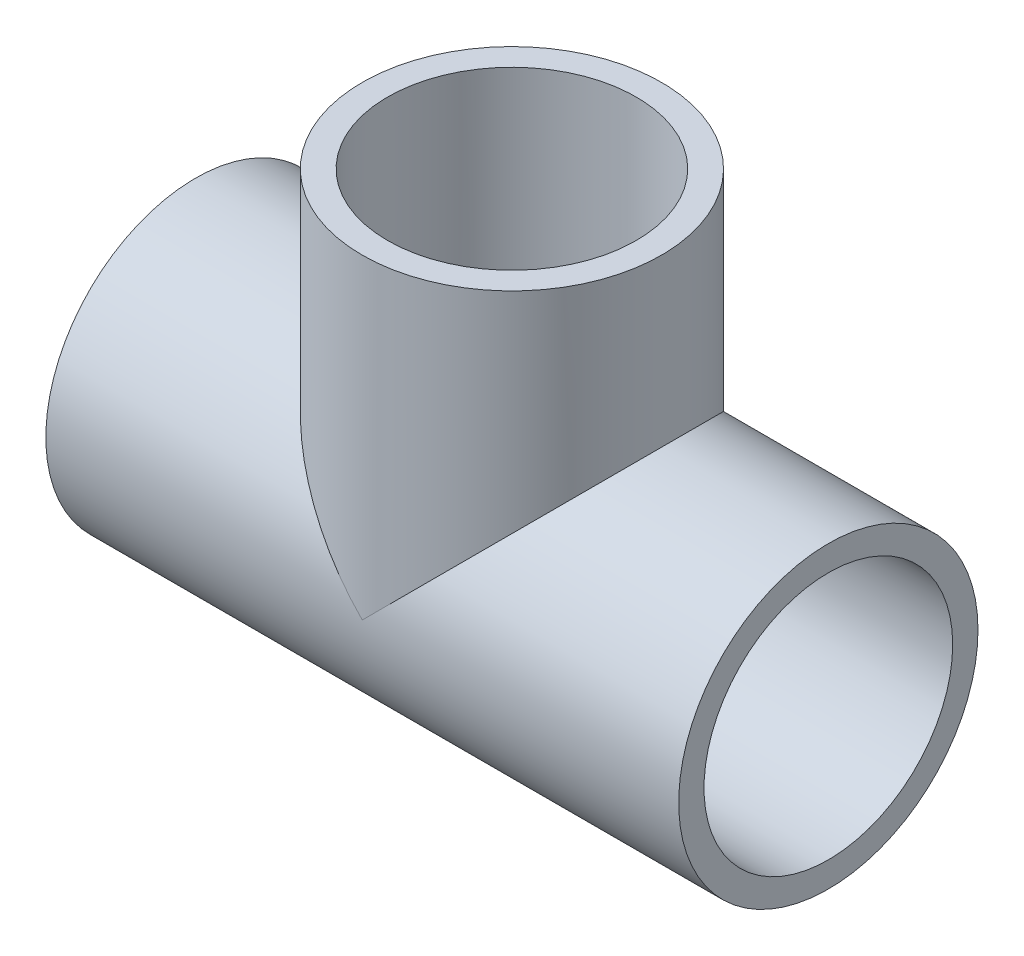
from build123d import *

# Parameters (mm, degrees)
CROQUIS1_R              = 20.1
CROQUIS1_R_2            = 16.7
SALIENTE_EXTRUIR1_DEPTH = 85
CROQUIS2_R              = 20.1
CROQUIS2_R_2            = 16.7
SALIENTE_EXTRUIR2_DEPTH = 42.44
CROQUIS3_R              = 16.7
CORTAR_EXTRUIR1_DEPTH   = 84.497438367
CORTAR_EXTRUIR2_START   = -42.497438367
CROQUIS5_R              = 16.7
CORTAR_EXTRUIR2_DEPTH   = 42.497438367


with BuildPart() as part:
    # Croquis1 → Saliente-Extruir1 (new body)
    with BuildSketch(Plane(origin=(0, 0, 0), x_dir=(0, 0, -1), z_dir=(1, 0, 0))):
        Circle(CROQUIS1_R)
        Circle(CROQUIS1_R_2, mode=Mode.SUBTRACT)
    extrude(amount=SALIENTE_EXTRUIR1_DEPTH)

    # Croquis2 → Saliente-Extruir2 (add)
    with BuildSketch(Plane(origin=(0, 0, 0), x_dir=(1, 0, 0), z_dir=(0, 1, 0))):
        with Locations((42.5, 0)):
            Circle(CROQUIS2_R)
        with Locations((42.5, 0)):
            Circle(CROQUIS2_R_2, mode=Mode.SUBTRACT)
    extrude(amount=SALIENTE_EXTRUIR2_DEPTH)

    # Croquis3 → Cortar-Extruir1 (cut)
    with BuildSketch(Plane.ZY):
        Circle(CROQUIS3_R)
    extrude(amount=-CORTAR_EXTRUIR1_DEPTH, mode=Mode.SUBTRACT)

    # Croquis5 → Cortar-Extruir2 (cut)
    with BuildSketch(Plane(origin=(0, 42.44, 0), x_dir=(1, 0, 0), z_dir=(0, 1, 0)).offset(CORTAR_EXTRUIR2_START)):
        with Locations((42.5, 0)):
            Circle(CROQUIS5_R)
    extrude(amount=CORTAR_EXTRUIR2_DEPTH, mode=Mode.SUBTRACT)


solid = part.part
